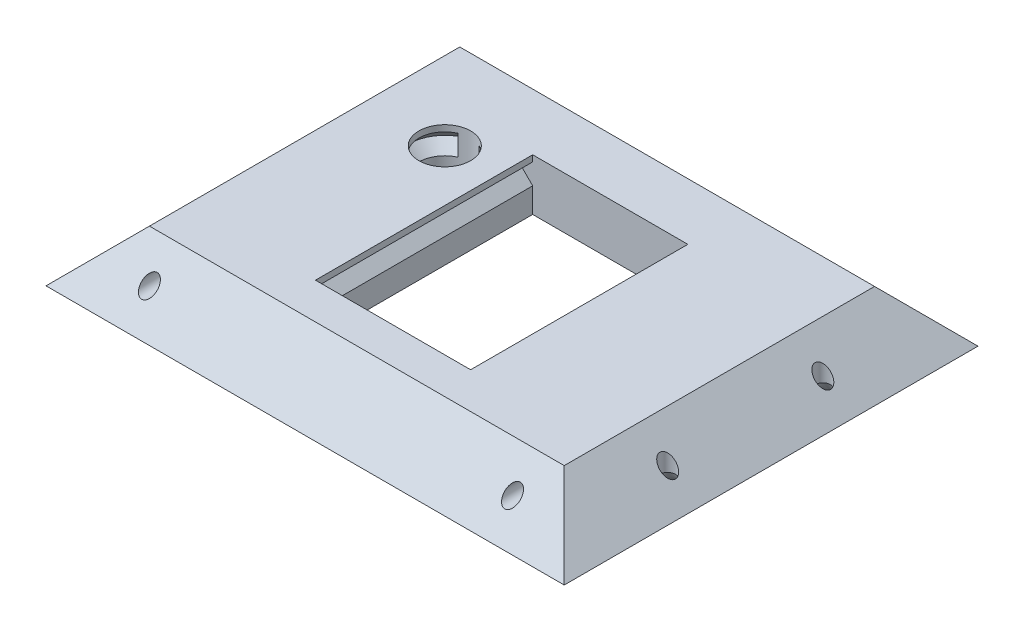
from build123d import *

# Parameters (mm, degrees)
SKETCH_4_R          = 1.5
CUT_EXTRUDE_1_DEPTH = 20
SKETCH_5_R          = 1.5
CUT_EXTRUDE_2_DEPTH = 65.884590004
SKETCH3_R           = 5
SKETCH3_W           = 30
SKETCH3_H           = 42
CUT_EXTRUDE1_DEPTH  = 65.884590004
CUT_EXTRUDE2_DEPTH  = 42
CUT_EXTRUDE_3_DEPTH = 0.6


with BuildPart() as part:
    # Эскиз1 → Loft 1 section 0
    with BuildSketch(Plane(origin=(0, 0, 0), x_dir=(1, 0, 0), z_dir=(0, 1, 0))):
        with BuildLine():
            Line((-50.1, -40), (50.1, -40))
            Line((50.1, -40), (50.1, 40))
            Line((50.1, 40), (-50.1, 40))
            Line((-50.1, 40), (-50.1, -40))
        make_face()
    # Эскиз2 → Loft 1 section 1
    with BuildSketch(Plane(origin=(0, 10, 0), x_dir=(1, 0, 0), z_dir=(0, 1, 0))):
        with BuildLine():
            Line((40.1, -30), (40.1, 30))
            Line((40.1, 30), (-40.1, 30))
            Line((-40.1, 30), (-40.1, -30))
            Line((-40.1, -30), (40.1, -30))
        make_face()
    loft()

    # Эскиз4 → Вырез-Вытянуть1 (cut)
    with BuildSketch(Plane.XY.offset(40)):
        with Locations((-35.1, 5)):
            Circle(SKETCH_4_R)
        with Locations(Location((35.1, 5, 0), (0, 0, 270))):
            Circle(SKETCH_4_R)
    cut_extrude_1 = extrude(amount=-CUT_EXTRUDE_1_DEPTH, mode=Mode.SUBTRACT)

    # Зеркальное отражение1: Вырез-Вытянуть1 across plane
    add(cut_extrude_1.mirror(Plane.XY), mode=Mode.SUBTRACT)

    # Эскиз5 → Вырез-Вытянуть2 (cut, through all)
    with BuildSketch(Plane.XZ):
        with Locations(Location((-45.1, 15, 0), (0, 0, 270))):
            Circle(SKETCH_5_R)
        with Locations(Location((-45.1, -15, 0), (0, 0, 180))):
            Circle(SKETCH_5_R)
        with Locations(Location((45.1, -15, 0), (0, 0, 270))):
            Circle(SKETCH_5_R)
        with Locations((45.1, 15)):
            Circle(SKETCH_5_R)
    extrude(amount=-CUT_EXTRUDE_2_DEPTH, mode=Mode.SUBTRACT)

    # Cut-Loft1: read off the stored shape, not the designer's step
    # Cut-Loft1: loft between two sections, ruled curve by curve
    cut_loft1_from = [
        Edge.make_bspline([(-43.923484762, 2.8, 15.930490137), (-45.784465036, 2.8, 18.283520613), (-48.137495512, 2.8, 16.422540339), (-46.276515238, 2.8, 14.069509863), (-44.415534964, 2.8, 11.716479387), (-42.062504488, 2.8, 13.577459661), (-43.923484762, 2.8, 15.930490137)], [0, 0, 0, 0, 0.5, 0.5, 0.5, 1, 1, 1, 1], 3, [1, 0.333333333, 0.333333333, 1, 0.333333333, 0.333333333, 1]),
    ]
    cut_loft1_to = [
        Edge.make_bspline([(-43.881334244, 0, 18.066733405), (-50.014801053, 0, 20.504064917), (-52.452132565, 0, 14.370598107), (-46.318665756, 0, 11.933266595), (-40.185198947, 0, 9.495935083), (-37.747867435, 0, 15.629401893), (-43.881334244, 0, 18.066733405)], [0, 0, 0, 0, 0.5, 0.5, 0.5, 1, 1, 1, 1], 3, [1, 0.333333333, 0.333333333, 1, 0.333333333, 0.333333333, 1]),
    ]
    cut_loft1 = Solid(Shell([*[Face.make_surface_from_curves(cut_loft1_from[k], cut_loft1_to[k]) for k in range(1)], Face(Wire(cut_loft1_from)), Face(Wire(cut_loft1_to))]))
    add(cut_loft1, mode=Mode.SUBTRACT)

    # Mirror1: Cut-Loft1 across plane
    add(cut_loft1.mirror(Plane.XY), mode=Mode.SUBTRACT)

    # Mirror2: read off the stored shape, not the designer's step
    # Mirror2: loft between two sections, ruled curve by curve
    mirror2_from = [
        Edge.make_bspline([(43.923484762, 2.8, 15.930490137), (45.784465036, 2.8, 18.283520613), (48.137495512, 2.8, 16.422540339), (46.276515238, 2.8, 14.069509863), (44.415534964, 2.8, 11.716479387), (42.062504488, 2.8, 13.577459661), (43.923484762, 2.8, 15.930490137)], [0, 0, 0, 0, 0.5, 0.5, 0.5, 1, 1, 1, 1], 3, [1, 0.333333333, 0.333333333, 1, 0.333333333, 0.333333333, 1]),
    ]
    mirror2_to = [
        Edge.make_bspline([(43.881334244, 0, 18.066733405), (50.014801053, 0, 20.504064917), (52.452132565, 0, 14.370598107), (46.318665756, 0, 11.933266595), (40.185198947, 0, 9.495935083), (37.747867435, 0, 15.629401893), (43.881334244, 0, 18.066733405)], [0, 0, 0, 0, 0.5, 0.5, 0.5, 1, 1, 1, 1], 3, [1, 0.333333333, 0.333333333, 1, 0.333333333, 0.333333333, 1]),
    ]
    mirror2 = Solid(Shell([*[Face.make_surface_from_curves(mirror2_from[k], mirror2_to[k]) for k in range(1)], Face(Wire(mirror2_from)), Face(Wire(mirror2_to))]))
    add(mirror2, mode=Mode.SUBTRACT)

    # Mirror2 2: loft between two sections, ruled curve by curve
    mirror2_2_from = [
        Edge.make_bspline([(43.923484762, 2.8, -15.930490137), (45.784465036, 2.8, -18.283520613), (48.137495512, 2.8, -16.422540339), (46.276515238, 2.8, -14.069509863), (44.415534964, 2.8, -11.716479387), (42.062504488, 2.8, -13.577459661), (43.923484762, 2.8, -15.930490137)], [0, 0, 0, 0, 0.5, 0.5, 0.5, 1, 1, 1, 1], 3, [1, 0.333333333, 0.333333333, 1, 0.333333333, 0.333333333, 1]),
    ]
    mirror2_2_to = [
        Edge.make_bspline([(43.881334244, 0, -18.066733405), (50.014801053, 0, -20.504064917), (52.452132565, 0, -14.370598107), (46.318665756, 0, -11.933266595), (40.185198947, 0, -9.495935083), (37.747867435, 0, -15.629401893), (43.881334244, 0, -18.066733405)], [0, 0, 0, 0, 0.5, 0.5, 0.5, 1, 1, 1, 1], 3, [1, 0.333333333, 0.333333333, 1, 0.333333333, 0.333333333, 1]),
    ]
    mirror2_2 = Solid(Shell([*[Face.make_surface_from_curves(mirror2_2_from[k], mirror2_2_to[k]) for k in range(1)], Face(Wire(mirror2_2_from)), Face(Wire(mirror2_2_to))]))
    add(mirror2_2, mode=Mode.SUBTRACT)

    # Sketch3 → Cut-Extrude1 (cut, through all)
    with BuildSketch(Plane.XZ):
        with Locations(Location((-25, -12, 0), (0, 0, 270))):
            Circle(SKETCH3_R)
        with Locations((0, 2)):
            Rectangle(SKETCH3_W, SKETCH3_H)
    extrude(amount=-CUT_EXTRUDE1_DEPTH, mode=Mode.SUBTRACT)

    # Sketch4 → Cut-Extrude2 (cut)
    with BuildSketch(Plane.XY.offset(-19)):
        Polygon((-15, 8.8), (-17, 6.8), (-15, 4.8), align=None)
        Polygon((15, 4.8), (15, 8.8), (17, 6.8), align=None)
    extrude(amount=CUT_EXTRUDE2_DEPTH, mode=Mode.SUBTRACT)

    # Loft 1 2: read off the stored shape, not the designer's step
    # Loft 1 2: loft between two sections, ruled curve by curve
    loft_1_2_from = [
        Edge.make_bspline([(-23, 6.8, -18.708203932), (-14.818181818, 6.8, -16.268857048), (-14.818181818, 6.8, -7.731142952), (-23, 6.8, -5.291796068)], [0, 0, 0, 0, 1, 1, 1, 1], 3, [1, 0.523809524, 0.523809524, 1]),
        Edge.make_line((-23, 6.8, -5.291796068), (-23, 6.8, -18.708203932)),
    ]
    loft_1_2_to = [
        Edge.make_bspline([(-23, 4.8, -16.582575695), (-18.333333333, 4.8, -14.545875386), (-18.333333333, 4.8, -9.454124614), (-23, 4.8, -7.417424305)], [0, 0, 0, 0, 1, 1, 1, 1], 3, [1, 0.6, 0.6, 1]),
        Edge.make_line((-23, 4.8, -7.417424305), (-23, 4.8, -16.582575695)),
    ]
    loft_1_2 = Solid(Shell([*[Face.make_surface_from_curves(loft_1_2_from[k], loft_1_2_to[k]) for k in range(2)], Face(Wire(loft_1_2_from)), Face(Wire(loft_1_2_to))]))
    add(loft_1_2, mode=Mode.SUBTRACT)

    # Вырез-По сечениям2: read off the stored shape, not the designer's step
    # Вырез-По сечениям2: loft between two sections, ruled curve by curve
    loft_2_from = [
        Edge.make_bspline([(-27, 6.8, -5.291796068), (-35.181818182, 6.8, -7.731142952), (-35.181818182, 6.8, -16.268857048), (-27, 6.8, -18.708203932)], [0, 0, 0, 0, 1, 1, 1, 1], 3, [1, 0.523809524, 0.523809524, 1]),
        Edge.make_line((-27, 6.8, -18.708203932), (-27, 6.8, -5.291796068)),
    ]
    loft_2_to = [
        Edge.make_bspline([(-27, 4.8, -7.417424305), (-31.666666667, 4.8, -9.454124614), (-31.666666667, 4.8, -14.545875386), (-27, 4.8, -16.582575695)], [0, 0, 0, 0, 1, 1, 1, 1], 3, [1, 0.6, 0.6, 1]),
        Edge.make_line((-27, 4.8, -16.582575695), (-27, 4.8, -7.417424305)),
    ]
    loft_2 = Solid(Shell([*[Face.make_surface_from_curves(loft_2_from[k], loft_2_to[k]) for k in range(2)], Face(Wire(loft_2_from)), Face(Wire(loft_2_to))]))
    add(loft_2, mode=Mode.SUBTRACT)

    # Зеркальное отражение2: Loft 1 2, Вырез-По сечениям2 across plane
    add(loft_1_2.mirror(Plane(origin=(0, 6.8, 0), x_dir=(0, 0, 1), z_dir=(0, -1, 0))), mode=Mode.SUBTRACT)
    add(loft_2.mirror(Plane(origin=(0, 6.8, 0), x_dir=(0, 0, 1), z_dir=(0, -1, 0))), mode=Mode.SUBTRACT)

    # Эскиз8 → Вырез-Вытянуть3 (cut)
    with BuildSketch(Plane.XZ):
        Polygon((-35.1, 5), (-35.1, -25), (-5.1, -25), (-5.1, -25.5), (-4.1, -24.5), (-5.1, -23.5), (-5.1, -24), (-34.1, -24), (-34.1, 5), (-33.6, 5), (-34.6, 6), (-35.6, 5), align=None)
    extrude(amount=-CUT_EXTRUDE_3_DEPTH, mode=Mode.SUBTRACT)


solid = part.part
